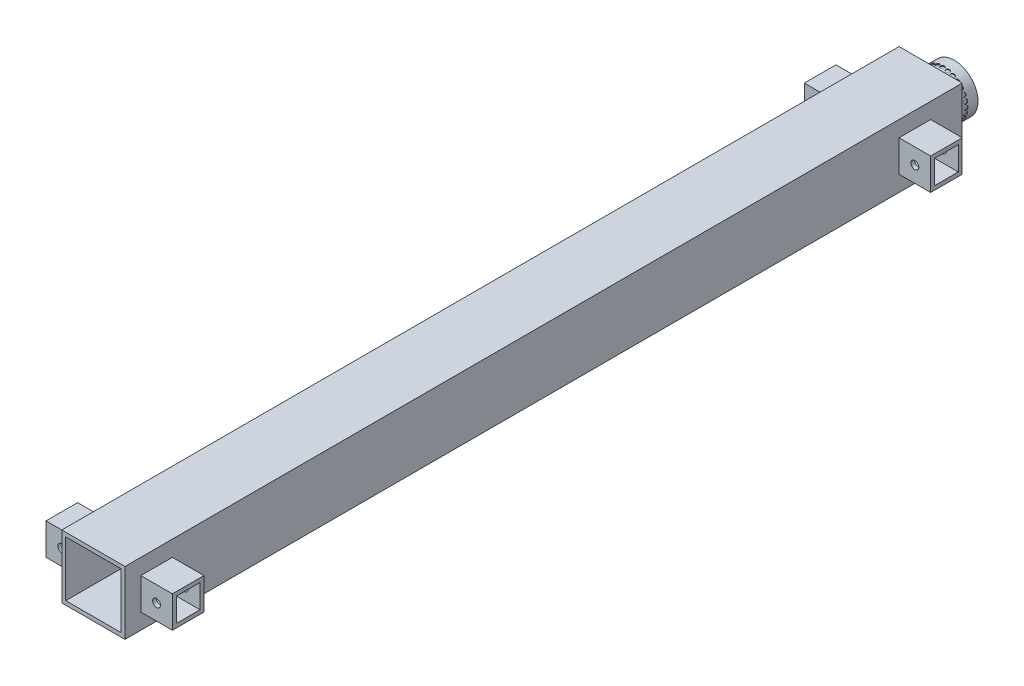
from build123d import *

# Parameters (mm, degrees)
SKETCH1_W                = 101.6
SKETCH1_H                = 101.6
SKETCH1_W_2              = 88.9
SKETCH1_H_2              = 88.9
BOSS_EXTRUDE1_DEPTH      = 1346.2
SKETCH2_W                = 101.6
SKETCH2_H                = 6.35
BOSS_EXTRUDE2_DEPTH      = 101.6
SKETCH3_R                = 38.1
BOSS_EXTRUDE3_DEPTH      = 38.1
SKETCH4_R                = 3.175
CUT_EXTRUDE1_DEPTH       = 13.97
CRVPATTERN1_START        = -38.1000001
CRVPATTERN1_OUTLINE_R    = 3.175
CRVPATTERN1_DEPTH        = 1.2700001
CRVPATTERN1_2_OUTLINE_R  = 3.175
CRVPATTERN1_2_DEPTH      = 1.2700001
CRVPATTERN1_START_2      = 36.83
CRVPATTERN1_3_OUTLINE_R  = 3.175
CRVPATTERN1_3_DEPTH      = 1.270000064
CRVPATTERN1_4_OUTLINE_R  = 3.175
CRVPATTERN1_4_DEPTH      = 1.2700001
CRVPATTERN1_5_OUTLINE_R  = 3.175
CRVPATTERN1_5_DEPTH      = 1.2700001
CRVPATTERN1_6_OUTLINE_R  = 3.175
CRVPATTERN1_6_DEPTH      = 1.2700001
CRVPATTERN1_7_OUTLINE_R  = 3.175
CRVPATTERN1_7_DEPTH      = 1.270000064
CRVPATTERN1_8_OUTLINE_R  = 3.175
CRVPATTERN1_8_DEPTH      = 1.2700001
CRVPATTERN1_9_OUTLINE_R  = 3.175
CRVPATTERN1_9_DEPTH      = 1.270000064
CRVPATTERN1_10_OUTLINE_R = 3.175
CRVPATTERN1_10_DEPTH     = 1.2700001
CRVPATTERN1_11_OUTLINE_R = 3.175
CRVPATTERN1_11_DEPTH     = 1.270000064
CRVPATTERN1_12_OUTLINE_R = 3.175
CRVPATTERN1_12_DEPTH     = 1.2700001
CRVPATTERN1_13_OUTLINE_R = 3.175
CRVPATTERN1_13_DEPTH     = 1.270000064
CRVPATTERN1_14_OUTLINE_R = 3.175
CRVPATTERN1_14_DEPTH     = 1.2700001
CRVPATTERN1_15_OUTLINE_R = 3.175
CRVPATTERN1_15_DEPTH     = 1.270000064
CRVPATTERN1_16_OUTLINE_R = 3.175
CRVPATTERN1_16_DEPTH     = 1.2700001
CRVPATTERN1_17_OUTLINE_R = 3.175
CRVPATTERN1_17_DEPTH     = 1.270000064
CRVPATTERN1_18_OUTLINE_R = 3.175
CRVPATTERN1_18_DEPTH     = 1.2700001
CRVPATTERN1_19_OUTLINE_R = 3.175
CRVPATTERN1_19_DEPTH     = 1.270000064
CRVPATTERN1_20_OUTLINE_R = 3.175
CRVPATTERN1_20_DEPTH     = 1.2700001
CRVPATTERN1_21_OUTLINE_R = 3.175
CRVPATTERN1_21_DEPTH     = 1.270000064
CRVPATTERN1_22_OUTLINE_R = 3.175
CRVPATTERN1_22_DEPTH     = 1.2700001
CRVPATTERN1_23_OUTLINE_R = 3.175
CRVPATTERN1_23_DEPTH     = 1.270000064
CRVPATTERN1_24_OUTLINE_R = 3.175
CRVPATTERN1_24_DEPTH     = 1.2700001
CRVPATTERN1_25_OUTLINE_R = 3.175
CRVPATTERN1_25_DEPTH     = 1.270000064
CRVPATTERN1_26_OUTLINE_R = 3.175
CRVPATTERN1_26_DEPTH     = 1.2700001
CRVPATTERN1_27_OUTLINE_R = 3.175
CRVPATTERN1_27_DEPTH     = 1.270000064
SKETCH5_W                = 50.8
SKETCH5_H                = 50.8
SKETCH5_W_2              = 38.1
SKETCH5_H_2              = 38.1
BOSS_EXTRUDE4_DEPTH      = 50.8
SKETCH6_W                = 50.8
SKETCH6_H                = 50.8
SKETCH6_W_2              = 38.1
SKETCH6_H_2              = 38.1
BOSS_EXTRUDE5_DEPTH      = 50.8
SKETCH7_W                = 50.8
SKETCH7_H                = 50.8
SKETCH7_W_2              = 38.1
SKETCH7_H_2              = 38.1
BOSS_EXTRUDE6_DEPTH      = 50.8
SKETCH8_W                = 50.8
SKETCH8_H                = 50.8
SKETCH8_W_2              = 38.1
SKETCH8_H_2              = 38.1
BOSS_EXTRUDE7_DEPTH      = 50.8
CUT_EXTRUDE2_REACH       = 1365.639
SKETCH9_R                = 6.35


# Read off the part's stored shape, not the designer's step: CrvPattern1
with BuildPart() as part:
    # Sketch1 → Boss-Extrude1 (new body)
    with BuildSketch(Plane.XY):
        Rectangle(SKETCH1_W, SKETCH1_H)
        Rectangle(SKETCH1_W_2, SKETCH1_H_2, mode=Mode.SUBTRACT)
    extrude(amount=-BOSS_EXTRUDE1_DEPTH)

    # Sketch2 → Boss-Extrude2 (add)
    with BuildSketch(Plane(origin=(0, 50.8, 0), x_dir=(1, 0, 0), z_dir=(0, 1, 0))):
        with Locations((0, 1343.025)):
            Rectangle(SKETCH2_W, SKETCH2_H)
    extrude(amount=-BOSS_EXTRUDE2_DEPTH)

    # Sketch3 → Boss-Extrude3 (add)
    with BuildSketch(Plane(origin=(0, 0, -1346.2), x_dir=(-1, 0, 0), z_dir=(0, 0, -1))):
        with Locations(Location((0, 0, 0), (0, 0, 180))):
            Circle(SKETCH3_R)
    extrude(amount=BOSS_EXTRUDE3_DEPTH)

    # Sketch4 → Cut-Extrude1 (cut)
    with BuildSketch(Plane(origin=(0, 50.8, 0), x_dir=(1, 0, 0), z_dir=(0, 1, 0))):
        with Locations(Location((0, 1365.25, 0), (0, 0, 270))):
            Circle(SKETCH4_R)
    extrude(amount=-CUT_EXTRUDE1_DEPTH, mode=Mode.SUBTRACT)

    # CrvPattern1 outline → CrvPattern1 (cut)
    with BuildSketch(Plane(origin=(0, 0, 0), x_dir=(1, 0, 0), z_dir=(0, 1, 0)).offset(CRVPATTERN1_START)):
        with Locations((0, 1365.25)):
            Circle(CRVPATTERN1_OUTLINE_R)
    extrude(amount=CRVPATTERN1_DEPTH, mode=Mode.SUBTRACT)

    # CrvPattern1 2 outline → CrvPattern1 2 (cut)
    with BuildSketch(Plane(origin=(0, 0, 0), x_dir=(0.9749279121818236, -0.22252093395631395, 0), z_dir=(0.22252093395631395, 0.9749279121818237, 0)).offset(CRVPATTERN1_START)):
        with Locations((0, 1365.25)):
            Circle(CRVPATTERN1_2_OUTLINE_R)
    extrude(amount=CRVPATTERN1_2_DEPTH, mode=Mode.SUBTRACT)

    # CrvPattern1 3 outline → CrvPattern1 3 (cut)
    with BuildSketch(Plane(origin=(0, 0, 0), x_dir=(0.9749279121818236, -0.22252093395631395, 0), z_dir=(0.22252093395631395, 0.9749279121818237, 0)).offset(CRVPATTERN1_START_2)):
        with Locations((0, 1365.25)):
            Circle(CRVPATTERN1_3_OUTLINE_R)
    extrude(amount=CRVPATTERN1_3_DEPTH, mode=Mode.SUBTRACT)

    # CrvPattern1 4 outline → CrvPattern1 4 (cut)
    with BuildSketch(Plane.YZ.offset(CRVPATTERN1_START)):
        with Locations((0, -1365.25)):
            Circle(CRVPATTERN1_4_OUTLINE_R)
    extrude(amount=CRVPATTERN1_4_DEPTH, mode=Mode.SUBTRACT)

    # CrvPattern1 5 outline → CrvPattern1 5 (cut)
    with BuildSketch(Plane.YZ.offset(CRVPATTERN1_START_2)):
        with Locations((0, -1365.25)):
            Circle(CRVPATTERN1_5_OUTLINE_R)
    extrude(amount=CRVPATTERN1_5_DEPTH, mode=Mode.SUBTRACT)

    # CrvPattern1 6 outline → CrvPattern1 6 (cut)
    with BuildSketch(Plane(origin=(0, 0, 0), x_dir=(-0.22252093395630096, 0.9749279121818267, 0), z_dir=(0.9749279121818267, 0.22252093395630093, 0)).offset(CRVPATTERN1_START)):
        with Locations((0, -1365.25)):
            Circle(CRVPATTERN1_6_OUTLINE_R)
    extrude(amount=CRVPATTERN1_6_DEPTH, mode=Mode.SUBTRACT)

    # CrvPattern1 7 outline → CrvPattern1 7 (cut)
    with BuildSketch(Plane(origin=(0, 0, 0), x_dir=(-0.22252093395630096, 0.9749279121818267, 0), z_dir=(0.9749279121818267, 0.22252093395630093, 0)).offset(CRVPATTERN1_START_2)):
        with Locations((0, -1365.25)):
            Circle(CRVPATTERN1_7_OUTLINE_R)
    extrude(amount=CRVPATTERN1_7_DEPTH, mode=Mode.SUBTRACT)

    # CrvPattern1 8 outline → CrvPattern1 8 (cut)
    with BuildSketch(Plane(origin=(0, 0, 0), x_dir=(0.6234898018587219, -0.781831482468039, 0), z_dir=(0.781831482468039, 0.623489801858722, 0)).offset(CRVPATTERN1_START)):
        with Locations((0, 1365.25)):
            Circle(CRVPATTERN1_8_OUTLINE_R)
    extrude(amount=CRVPATTERN1_8_DEPTH, mode=Mode.SUBTRACT)

    # CrvPattern1 9 outline → CrvPattern1 9 (cut)
    with BuildSketch(Plane(origin=(0, 0, 0), x_dir=(0.6234898018587219, -0.781831482468039, 0), z_dir=(0.781831482468039, 0.623489801858722, 0)).offset(CRVPATTERN1_START_2)):
        with Locations((0, 1365.25)):
            Circle(CRVPATTERN1_9_OUTLINE_R)
    extrude(amount=CRVPATTERN1_9_DEPTH, mode=Mode.SUBTRACT)

    # CrvPattern1 10 outline → CrvPattern1 10 (cut)
    with BuildSketch(Plane(origin=(0, 0, 0), x_dir=(-0.4338837391175452, 0.9009688679024254, 0), z_dir=(0.9009688679024254, 0.4338837391175452, 0)).offset(CRVPATTERN1_START)):
        with Locations((0, -1365.25)):
            Circle(CRVPATTERN1_10_OUTLINE_R)
    extrude(amount=CRVPATTERN1_10_DEPTH, mode=Mode.SUBTRACT)

    # CrvPattern1 11 outline → CrvPattern1 11 (cut)
    with BuildSketch(Plane(origin=(0, 0, 0), x_dir=(-0.4338837391175452, 0.9009688679024254, 0), z_dir=(0.9009688679024254, 0.4338837391175452, 0)).offset(CRVPATTERN1_START_2)):
        with Locations((0, -1365.25)):
            Circle(CRVPATTERN1_11_OUTLINE_R)
    extrude(amount=CRVPATTERN1_11_DEPTH, mode=Mode.SUBTRACT)

    # CrvPattern1 12 outline → CrvPattern1 12 (cut)
    with BuildSketch(Plane(origin=(0, 0, 0), x_dir=(0.6234898018587436, 0.7818314824680217, 0), z_dir=(0.7818314824680217, -0.6234898018587438, 0)).offset(CRVPATTERN1_START)):
        with Locations((0, -1365.25)):
            Circle(CRVPATTERN1_12_OUTLINE_R)
    extrude(amount=CRVPATTERN1_12_DEPTH, mode=Mode.SUBTRACT)

    # CrvPattern1 13 outline → CrvPattern1 13 (cut)
    with BuildSketch(Plane(origin=(0, 0, 0), x_dir=(0.6234898018587436, 0.7818314824680217, 0), z_dir=(0.7818314824680217, -0.6234898018587438, 0)).offset(CRVPATTERN1_START_2)):
        with Locations((0, -1365.25)):
            Circle(CRVPATTERN1_13_OUTLINE_R)
    extrude(amount=CRVPATTERN1_13_DEPTH, mode=Mode.SUBTRACT)

    # CrvPattern1 14 outline → CrvPattern1 14 (cut)
    with BuildSketch(Plane(origin=(0, 0, 0), x_dir=(0.7818314824680384, 0.6234898018587227, 0), z_dir=(0.6234898018587227, -0.7818314824680386, 0)).offset(CRVPATTERN1_START)):
        with Locations((0, -1365.25)):
            Circle(CRVPATTERN1_14_OUTLINE_R)
    extrude(amount=CRVPATTERN1_14_DEPTH, mode=Mode.SUBTRACT)

    # CrvPattern1 15 outline → CrvPattern1 15 (cut)
    with BuildSketch(Plane(origin=(0, 0, 0), x_dir=(0.7818314824680384, 0.6234898018587227, 0), z_dir=(0.6234898018587227, -0.7818314824680386, 0)).offset(CRVPATTERN1_START_2)):
        with Locations((0, -1365.25)):
            Circle(CRVPATTERN1_15_OUTLINE_R)
    extrude(amount=CRVPATTERN1_15_DEPTH, mode=Mode.SUBTRACT)

    # CrvPattern1 16 outline → CrvPattern1 16 (cut)
    with BuildSketch(Plane(origin=(0, 0, 0), x_dir=(0.22252093395632788, 0.9749279121818205, 0), z_dir=(0.9749279121818205, -0.22252093395632788, 0)).offset(CRVPATTERN1_START)):
        with Locations((0, -1365.25)):
            Circle(CRVPATTERN1_16_OUTLINE_R)
    extrude(amount=CRVPATTERN1_16_DEPTH, mode=Mode.SUBTRACT)

    # CrvPattern1 17 outline → CrvPattern1 17 (cut)
    with BuildSketch(Plane(origin=(0, 0, 0), x_dir=(0.22252093395632788, 0.9749279121818205, 0), z_dir=(0.9749279121818205, -0.22252093395632788, 0)).offset(CRVPATTERN1_START_2)):
        with Locations((0, -1365.25)):
            Circle(CRVPATTERN1_17_OUTLINE_R)
    extrude(amount=CRVPATTERN1_17_DEPTH, mode=Mode.SUBTRACT)

    # CrvPattern1 18 outline → CrvPattern1 18 (cut)
    with BuildSketch(Plane(origin=(0, 0, 0), x_dir=(0.4338837391175702, 0.9009688679024134, 0), z_dir=(0.9009688679024134, -0.43388373911757017, 0)).offset(CRVPATTERN1_START)):
        with Locations((0, -1365.25)):
            Circle(CRVPATTERN1_18_OUTLINE_R)
    extrude(amount=CRVPATTERN1_18_DEPTH, mode=Mode.SUBTRACT)

    # CrvPattern1 19 outline → CrvPattern1 19 (cut)
    with BuildSketch(Plane(origin=(0, 0, 0), x_dir=(0.4338837391175702, 0.9009688679024134, 0), z_dir=(0.9009688679024134, -0.43388373911757017, 0)).offset(CRVPATTERN1_START_2)):
        with Locations((0, -1365.25)):
            Circle(CRVPATTERN1_19_OUTLINE_R)
    extrude(amount=CRVPATTERN1_19_DEPTH, mode=Mode.SUBTRACT)

    # CrvPattern1 20 outline → CrvPattern1 20 (cut)
    with BuildSketch(Plane(origin=(0, 0, 0), x_dir=(0.9749279121818265, 0.22252093395630188, 0), z_dir=(0.22252093395630188, -0.9749279121818265, 0)).offset(CRVPATTERN1_START)):
        with Locations((0, -1365.25)):
            Circle(CRVPATTERN1_20_OUTLINE_R)
    extrude(amount=CRVPATTERN1_20_DEPTH, mode=Mode.SUBTRACT)

    # CrvPattern1 21 outline → CrvPattern1 21 (cut)
    with BuildSketch(Plane(origin=(0, 0, 0), x_dir=(0.9749279121818265, 0.22252093395630188, 0), z_dir=(0.22252093395630188, -0.9749279121818265, 0)).offset(CRVPATTERN1_START_2)):
        with Locations((0, -1365.25)):
            Circle(CRVPATTERN1_21_OUTLINE_R)
    extrude(amount=CRVPATTERN1_21_DEPTH, mode=Mode.SUBTRACT)

    # CrvPattern1 22 outline → CrvPattern1 22 (cut)
    with BuildSketch(Plane(origin=(0, 0, 0), x_dir=(0.9009688679024249, 0.4338837391175461, 0), z_dir=(0.433883739117546, -0.900968867902425, 0)).offset(CRVPATTERN1_START)):
        with Locations((0, -1365.25)):
            Circle(CRVPATTERN1_22_OUTLINE_R)
    extrude(amount=CRVPATTERN1_22_DEPTH, mode=Mode.SUBTRACT)

    # CrvPattern1 23 outline → CrvPattern1 23 (cut)
    with BuildSketch(Plane(origin=(0, 0, 0), x_dir=(0.9009688679024249, 0.4338837391175461, 0), z_dir=(0.433883739117546, -0.900968867902425, 0)).offset(CRVPATTERN1_START_2)):
        with Locations((0, -1365.25)):
            Circle(CRVPATTERN1_23_OUTLINE_R)
    extrude(amount=CRVPATTERN1_23_DEPTH, mode=Mode.SUBTRACT)

    # CrvPattern1 24 outline → CrvPattern1 24 (cut)
    with BuildSketch(Plane(origin=(0, 0, 0), x_dir=(0.7818314824680291, -0.6234898018587343, 0), z_dir=(0.6234898018587343, 0.7818314824680292, 0)).offset(CRVPATTERN1_START)):
        with Locations((0, 1365.25)):
            Circle(CRVPATTERN1_24_OUTLINE_R)
    extrude(amount=CRVPATTERN1_24_DEPTH, mode=Mode.SUBTRACT)

    # CrvPattern1 25 outline → CrvPattern1 25 (cut)
    with BuildSketch(Plane(origin=(0, 0, 0), x_dir=(0.7818314824680291, -0.6234898018587343, 0), z_dir=(0.6234898018587343, 0.7818314824680292, 0)).offset(CRVPATTERN1_START_2)):
        with Locations((0, 1365.25)):
            Circle(CRVPATTERN1_25_OUTLINE_R)
    extrude(amount=CRVPATTERN1_25_DEPTH, mode=Mode.SUBTRACT)

    # CrvPattern1 26 outline → CrvPattern1 26 (cut)
    with BuildSketch(Plane(origin=(0, 0, 0), x_dir=(0.9009688679024191, -0.43388373911755806, 0), z_dir=(0.43388373911755806, 0.9009688679024191, 0)).offset(CRVPATTERN1_START)):
        with Locations((0, 1365.25)):
            Circle(CRVPATTERN1_26_OUTLINE_R)
    extrude(amount=CRVPATTERN1_26_DEPTH, mode=Mode.SUBTRACT)

    # CrvPattern1 27 outline → CrvPattern1 27 (cut)
    with BuildSketch(Plane(origin=(0, 0, 0), x_dir=(0.9009688679024191, -0.43388373911755806, 0), z_dir=(0.43388373911755806, 0.9009688679024191, 0)).offset(CRVPATTERN1_START_2)):
        with Locations((0, 1365.25)):
            Circle(CRVPATTERN1_27_OUTLINE_R)
    extrude(amount=CRVPATTERN1_27_DEPTH, mode=Mode.SUBTRACT)

    # Sketch5 → Boss-Extrude4 (add)
    with BuildSketch(Plane(origin=(50.8, 0, 0), x_dir=(0, 0, -1), z_dir=(1, 0, 0))):
        with Locations((1270, 0)):
            Rectangle(SKETCH5_W, SKETCH5_H)
        with Locations((1270, 0)):
            Rectangle(SKETCH5_W_2, SKETCH5_H_2, mode=Mode.SUBTRACT)
    extrude(amount=BOSS_EXTRUDE4_DEPTH)

    # Sketch6 → Boss-Extrude5 (add)
    with BuildSketch(Plane.ZY.offset(50.8)):
        with Locations((-1270, 0)):
            Rectangle(SKETCH6_W, SKETCH6_H)
        with Locations((-1270, 0)):
            Rectangle(SKETCH6_W_2, SKETCH6_H_2, mode=Mode.SUBTRACT)
    extrude(amount=BOSS_EXTRUDE5_DEPTH)

    # Sketch7 → Boss-Extrude6 (add)
    with BuildSketch(Plane.ZY.offset(50.8)):
        with Locations((-50.8, 0)):
            Rectangle(SKETCH7_W, SKETCH7_H)
        with Locations((-50.8, 0)):
            Rectangle(SKETCH7_W_2, SKETCH7_H_2, mode=Mode.SUBTRACT)
    extrude(amount=BOSS_EXTRUDE6_DEPTH)

    # Sketch8 → Boss-Extrude7 (add)
    with BuildSketch(Plane(origin=(50.8, 0, 0), x_dir=(0, 0, -1), z_dir=(1, 0, 0))):
        with Locations((50.8, 0)):
            Rectangle(SKETCH8_W, SKETCH8_H)
        with Locations((50.8, 0)):
            Rectangle(SKETCH8_W_2, SKETCH8_H_2, mode=Mode.SUBTRACT)
    extrude(amount=BOSS_EXTRUDE7_DEPTH)

    # Cut-Extrude2: up to this face of the body (flat: up to its plane)
    cut_extrude2_end = Plane(part.part.faces().sort_by_distance((-76.2, 0, -1295.4))[0])
    # Sketch9 → Cut-Extrude2 (cut, up to the picked face)
    with BuildSketch(Plane.XY.offset(-25.4), mode=Mode.PRIVATE) as cut_extrude2_sk1:
        with Locations((-76.2, 0)):
            Circle(SKETCH9_R)
    cut_extrude2_tool1 = split(extrude(cut_extrude2_sk1.sketch, amount=-CUT_EXTRUDE2_REACH, mode=Mode.PRIVATE), bisect_by=cut_extrude2_end, keep=Keep.BOTH, mode=Mode.PRIVATE)
    # Sketch9 → Cut-Extrude2 (cut, up to the picked face)
    with BuildSketch(Plane.XY.offset(-25.4), mode=Mode.PRIVATE) as cut_extrude2_sk2:
        with Locations(Location((76.2, 0, 0), (0, 0, 270))):
            Circle(SKETCH9_R)
    cut_extrude2_tool2 = split(extrude(cut_extrude2_sk2.sketch, amount=-CUT_EXTRUDE2_REACH, mode=Mode.PRIVATE), bisect_by=cut_extrude2_end, keep=Keep.BOTH, mode=Mode.PRIVATE)
    add(cut_extrude2_tool1.solids().sort_by(Axis((-76.2, 0, -25.4), (0, 0, -1)))[0], mode=Mode.SUBTRACT)
    add(cut_extrude2_tool2.solids().sort_by(Axis((76.2, 0, -25.4), (0, 0, -1)))[0], mode=Mode.SUBTRACT)


solid = part.part
